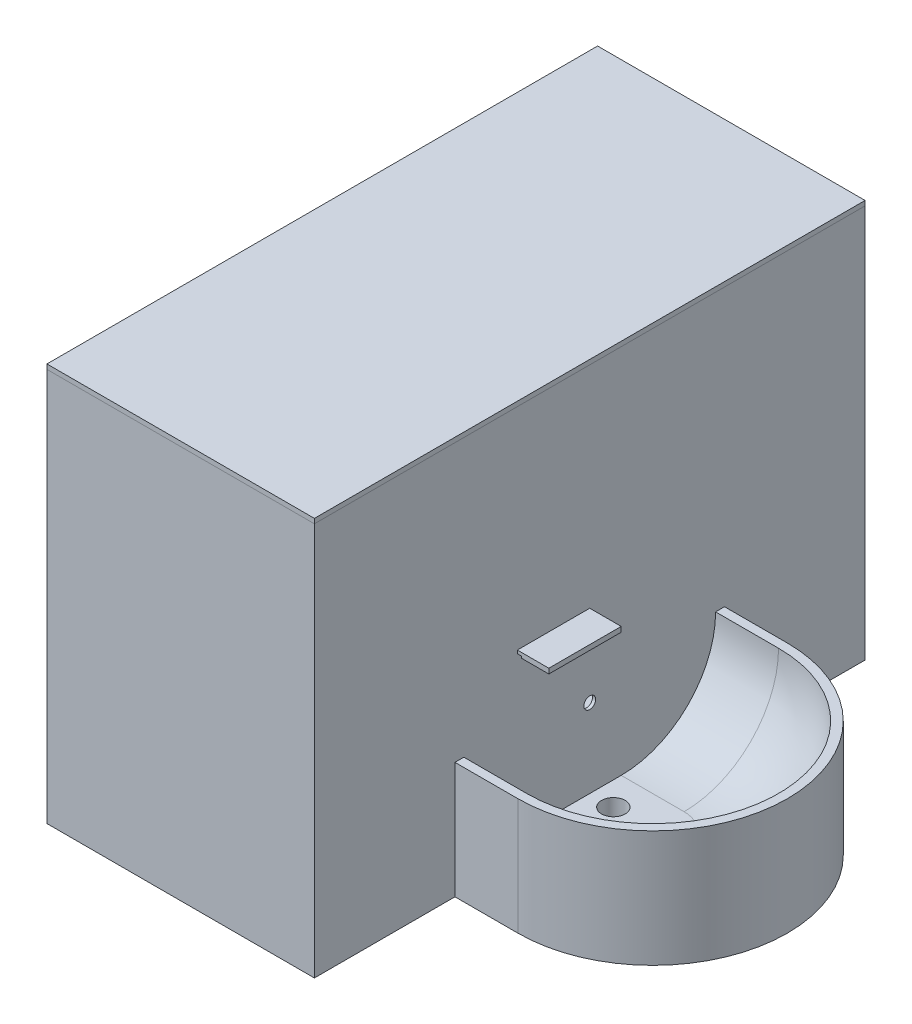
from build123d import *

# Parameters (mm, degrees)
REVOLU_O2_ANGLE           = 180
RESSALTO_EXTRUS_O1_DEPTH  = 40
ESBO_O3_W                 = 350
ESBO_O3_H                 = 250
RESSALTO_EXTRUS_O2_DEPTH  = 170
CASCA2_START              = -12.026151047
CASCA2_OUTLINE_W          = 166
CASCA2_OUTLINE_H          = 346
CASCA2_DEPTH              = 248
ESBO_O4_R                 = 7.5
CORTE_EXTRUS_O1_DEPTH     = 170
ESBO_O5_R                 = 8.5
ESBO_O5_R_2               = 7.5
RESSALTO_EXTRUS_O3_DEPTH  = 12.026151047
CORTE_EXTRUS_O3_REACH     = 341.424
ESBO_O6_R                 = 3.75
ESBO_O10_W                = 170
ESBO_O10_H                = 350
RESSALTO_EXTRUS_O13_DEPTH = 3
ESBO_O11_W                = 46
ESBO_O11_H                = 2
RESSALTO_EXTRUS_O15_DEPTH = 20
ESBO_O12_W                = 17.5
ESBO_O12_H                = 46
RESSALTO_EXTRUS_O17_DEPTH = 1.2


# Read off the part's stored shape, not the designer's step: Casca2
with BuildPart() as part:
    # Esboço1 → Revolução2 (revolve)
    with BuildSketch(Plane(origin=(0, 0, 0), x_dir=(0, 0, -1), z_dir=(1, 0, 0))):
        with BuildLine():
            Line((0, 0), (-20, 0))
            ThreePointArc((-20, 0), (-62.426406871, 17.573593129), (-80, 60))
            Line((-80, 60), (-85.654168524, 60))
            Line((-85.654168524, 60), (-85.654168524, -14.026151047))
            Line((-85.654168524, -14.026151047), (-83.654168524, -14.026151047))
            Line((-83.654168524, -14.026151047), (-83.654168524, 58))
            Line((-83.654168524, 58), (-81.967733539, 58))
            ThreePointArc((-81.967733539, 58), (-63.127717306, 15.457885097), (-20, -2))
            Line((-20, -2), (-2, -2))
            Line((-2, -2), (0, -2))
            Line((0, -2), (0, 0))
        make_face()
    revolve(axis=Axis((0, -14.026151047, 0), (0, 1, 0)), revolution_arc=REVOLU_O2_ANGLE)

    # Esboço2 → Ressalto-extrusão1 (add)
    with BuildSketch(Plane.ZY):
        with BuildLine():
            Line((-20, -2), (20, -2))
            ThreePointArc((20, -2), (63.127717306, 15.457885097), (81.967733539, 58))
            Line((81.967733539, 58), (83.654168524, 58))
            Line((83.654168524, 58), (83.654168524, -14.026151047))
            Line((83.654168524, -14.026151047), (85.654168524, -14.026151047))
            Line((85.654168524, -14.026151047), (85.654168524, 60))
            Line((85.654168524, 60), (80, 60))
            ThreePointArc((80, 60), (62.426406871, 17.573593129), (20, 0))
            Line((20, 0), (-20, 0))
            ThreePointArc((-20, 0), (-62.426406871, 17.573593129), (-80, 60))
            Line((-80, 60), (-85.654168524, 60))
            Line((-85.654168524, 60), (-85.654168524, -14.026151047))
            Line((-85.654168524, -14.026151047), (-83.654168524, -14.026151047))
            Line((-83.654168524, -14.026151047), (-83.654168524, 58))
            Line((-83.654168524, 58), (-81.967733539, 58))
            ThreePointArc((-81.967733539, 58), (-63.127717306, 15.457885097), (-20, -2))
        make_face()
    extrude(amount=RESSALTO_EXTRUS_O1_DEPTH)

    # Esboço3 → Ressalto-extrusão2 (add)
    with BuildSketch(Plane.ZY.offset(40)):
        with Locations((0, 110.973848953)):
            Rectangle(ESBO_O3_W, ESBO_O3_H)
    extrude(amount=RESSALTO_EXTRUS_O2_DEPTH)

    # Casca2 outline → Casca2 (cut)
    with BuildSketch(Plane(origin=(0, 0, 0), x_dir=(1, 0, 0), z_dir=(0, 1, 0)).offset(CASCA2_START)):
        with Locations((-125, 0)):
            Rectangle(CASCA2_OUTLINE_W, CASCA2_OUTLINE_H)
    extrude(amount=CASCA2_DEPTH, mode=Mode.SUBTRACT)

    # Esboço4 → Corte-extrusão1 (cut)
    with BuildSketch(Plane(origin=(0, 0, 0), x_dir=(1, 0, 0), z_dir=(0, 1, 0))):
        with Locations(Location((-25, 0, 0), (0, 0, 270))):
            Circle(ESBO_O4_R)
    extrude(amount=-CORTE_EXTRUS_O1_DEPTH, mode=Mode.SUBTRACT)

    # Esboço5 → Ressalto-extrusão3 (add)
    with BuildSketch(Plane.XZ.offset(2)):
        with Locations(Location((-25, 0, 0), (0, 0, 90))):
            Circle(ESBO_O5_R)
        with Locations(Location((-25, 0, 0), (0, 0, 90))):
            Circle(ESBO_O5_R_2, mode=Mode.SUBTRACT)
    extrude(amount=RESSALTO_EXTRUS_O3_DEPTH)

    # Esboço6 → Corte-extrusão3 (cut, up to next)
    with BuildSketch(Plane(origin=(-40, 0, 0), x_dir=(0, 0, -1), z_dir=(1, 0, 0)), mode=Mode.PRIVATE) as corte_extrus_o3_sk1:
        with Locations((0, 50)):
            Circle(ESBO_O6_R)
    corte_extrus_o3_tool1 = extrude(corte_extrus_o3_sk1.sketch, amount=-CORTE_EXTRUS_O3_REACH, mode=Mode.PRIVATE) & part.part
    add(corte_extrus_o3_tool1.solids().sort_by_distance((-40, 50, 0))[0], mode=Mode.SUBTRACT)

    # Esboço11 → Ressalto-extrusão15 (add)
    with BuildSketch(Plane(origin=(-40, 0, 0), x_dir=(0, 0, -1), z_dir=(1, 0, 0))):
        with Locations((-23, 101)):
            Rectangle(ESBO_O11_W, ESBO_O11_H)
    extrude(amount=RESSALTO_EXTRUS_O15_DEPTH)

    # Esboço12 → Ressalto-extrusão17 (add)
    with BuildSketch(Plane.XZ.offset(-100)):
        with Locations((-28.75, 23)):
            Rectangle(ESBO_O12_W, ESBO_O12_H)
    extrude(amount=RESSALTO_EXTRUS_O17_DEPTH)


with BuildPart() as body_2:
    # Esboço10 → Ressalto-extrusão13 (new body)
    with BuildSketch(Plane(origin=(0, 235.973848953, 0), x_dir=(1, 0, 0), z_dir=(0, 1, 0))):
        with Locations((-125, 0)):
            Rectangle(ESBO_O10_W, ESBO_O10_H)
    extrude(amount=RESSALTO_EXTRUS_O13_DEPTH)


solid = Compound([part.part, body_2.part])
